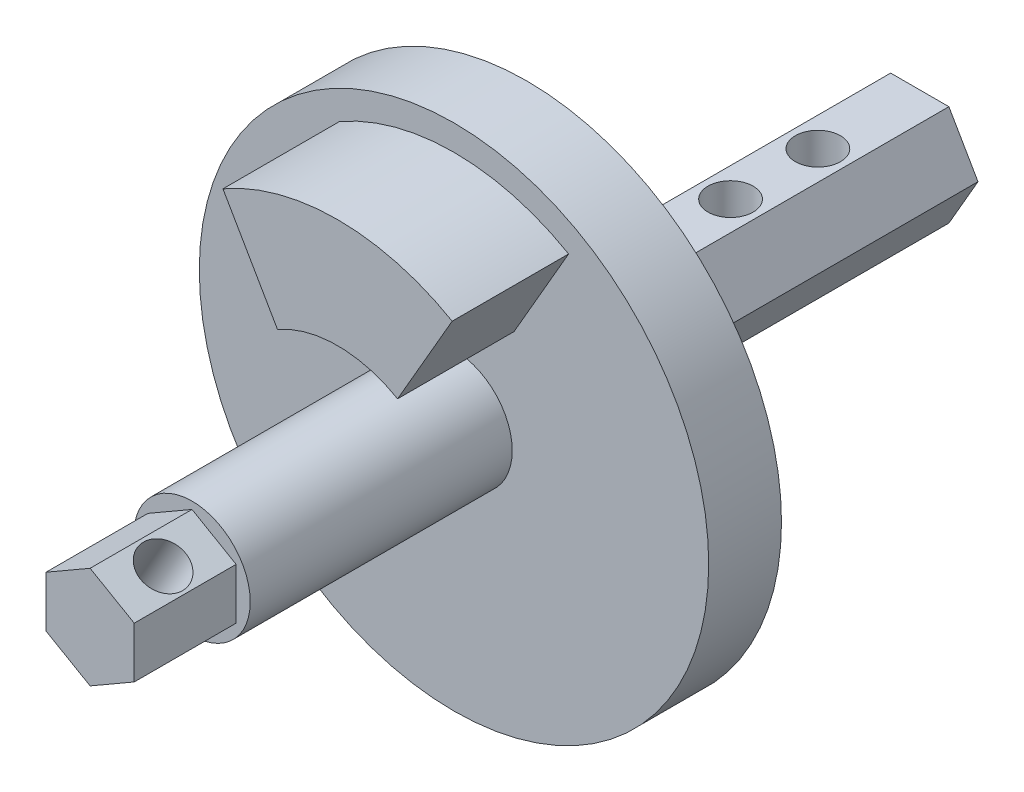
from build123d import *

# Parameters (mm, degrees)
SKETCH1_R           = 17.5
BOSS_EXTRUDE1_DEPTH = 2.5
BOSS_EXTRUDE2_DEPTH = 8
SKETCH3_R           = 4
BOSS_EXTRUDE3_DEPTH = 18
BOSS_EXTRUDE4_START = 7
SKETCH7_R           = 4
BOSS_EXTRUDE4_DEPTH = 7
BOSS_EXTRUDE5_DEPTH = 20
SKETCH10_R          = 1.55
CUT_EXTRUDE1_DEPTH  = 7
BOSS_EXTRUDE6_DEPTH = 7
SKETCH12_R          = 1.55
CUT_EXTRUDE2_DEPTH  = 6.1


with BuildPart() as part:
    # Sketch1 → Boss-Extrude1 (new, symmetric)
    with BuildSketch(Plane.XY):
        Circle(SKETCH1_R)
    extrude(amount=BOSS_EXTRUDE1_DEPTH, both=True)

    # Sketch2 → Boss-Extrude2 (add)
    with BuildSketch(Plane.XY.offset(2.5)):
        with BuildLine():
            Line((7.875, 13.63990011), (4.125, 7.144709581))
            ThreePointArc((4.125, 7.144709581), (0, 8.25), (-4.125, 7.144709581))
            Line((-4.125, 7.144709581), (-7.875, 13.63990011))
            ThreePointArc((-7.875, 13.63990011), (0, 15.75), (7.875, 13.63990011))
        make_face()
    extrude(amount=BOSS_EXTRUDE2_DEPTH)

    # Sketch3 → Boss-Extrude3 (add)
    with BuildSketch(Plane.XY.offset(2.5)):
        Circle(SKETCH3_R)
    extrude(amount=BOSS_EXTRUDE3_DEPTH)

    # Sketch7 → Boss-Extrude4 (add)
    with BuildSketch(Plane(origin=(0, 0, -2.5), x_dir=(-1, 0, 0), z_dir=(0, 0, -1)).offset(BOSS_EXTRUDE4_START)):
        Circle(SKETCH7_R)
    extrude(amount=-BOSS_EXTRUDE4_DEPTH)

    # Sketch9 → Boss-Extrude5 (add)
    with BuildSketch(Plane(origin=(0, 0, -9.5), x_dir=(-1, 0, 0), z_dir=(0, 0, -1))):
        Polygon((4, 0), (2, 3.464101615), (-2, 3.464101615), (-4, 0), (-2, -3.464101615), (2, -3.464101615), align=None)
    extrude(amount=BOSS_EXTRUDE5_DEPTH)

    # Sketch10 → Cut-Extrude1 (cut)
    with BuildSketch(Plane(origin=(0, -3.464101615, 0), x_dir=(-1, 0, 0), z_dir=(0, 1, 0))):
        with Locations((0, -22.5)):
            Circle(SKETCH10_R)
        with Locations((0, -16.5)):
            Circle(SKETCH10_R)
    extrude(amount=CUT_EXTRUDE1_DEPTH, mode=Mode.SUBTRACT)

    # Sketch11 → Boss-Extrude6 (add)
    with BuildSketch(Plane.XY.offset(20.5)):
        Polygon((3.031088913, 1.75), (0, 3.5), (-3.031088913, 1.75), (-3.031088913, -1.75), (0, -3.5), (3.031088913, -1.75), align=None)
    extrude(amount=BOSS_EXTRUDE6_DEPTH)

    # Sketch12 → Cut-Extrude2 (cut)
    with BuildSketch(Plane(origin=(-1.515544457, -2.625, 0), x_dir=(0.8660254037844372, -0.5000000000000026, 0), z_dir=(-0.5000000000000026, -0.8660254037844372, 0))):
        with Locations((0, 24)):
            Circle(SKETCH12_R)
    extrude(amount=-CUT_EXTRUDE2_DEPTH, mode=Mode.SUBTRACT)


solid = part.part
